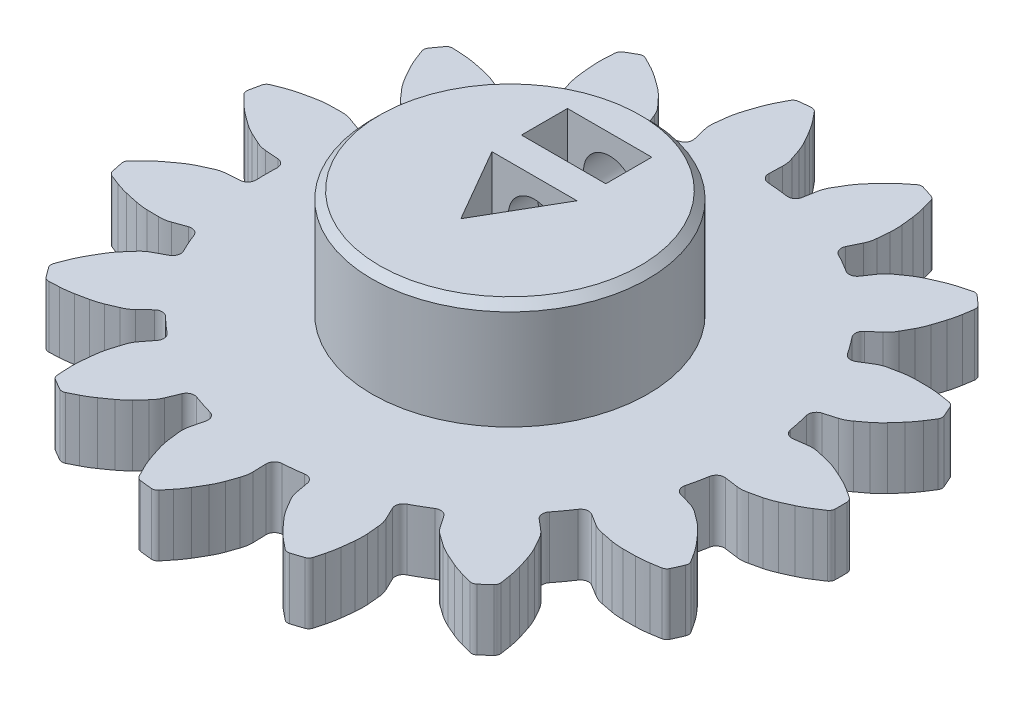
from build123d import *

# Parameters (mm, degrees)
BOSS_EXTRUDE1_DEPTH = 4
SKETCH2_R           = 9
BOSS_EXTRUDE2_DEPTH = 11
CUT_EXTRUDE1_DEPTH  = 711.462257137
SKETCH4_W           = 5.5
SKETCH4_H           = 3
CUT_EXTRUDE2_DEPTH  = 6
SKETCH5_R           = 1.7
CUT_EXTRUDE3_DEPTH  = 632.515680404
CHAMFER1_SIZE       = 0.5


with BuildPart() as part:
    # Sketch1 → Boss-Extrude1 (new body)
    with BuildSketch(Plane(origin=(0, 0, 0), x_dir=(1, 0, 0), z_dir=(0, 1, 0))):
        with BuildLine():
            Line((625.655538963, 307.001959395), (626.515572218, 307.118507349))
            ThreePointArc((626.515572218, 307.118507349), (626.884116246, 307.132277804), (627.248364172, 307.074504331))
            ThreePointArc((627.248364172, 307.074504331), (627.621576046, 306.989699865), (627.994774348, 306.904835695))
            ThreePointArc((627.994774348, 306.904835695), (628.37582392, 306.789350553), (628.746632196, 306.644309812))
            ThreePointArc((628.746632196, 306.644309812), (629.123956149, 306.476519105), (629.498991111, 306.303672745))
            ThreePointArc((629.498991111, 306.303672745), (629.880277829, 306.108693095), (630.247578808, 305.888496327))
            ThreePointArc((630.247578808, 305.888496327), (630.531649894, 305.70400205), (630.814613461, 305.517813601))
            ThreePointArc((630.814613461, 305.517813601), (630.944063756, 305.377153086), (630.993224545, 305.192420913))
            ThreePointArc((630.993224545, 305.192420913), (630.995899495, 304.99621856), (630.99679117, 304.8))
            ThreePointArc((630.99679117, 304.8), (630.995899495, 304.60378144), (630.993224545, 304.407579087))
            ThreePointArc((630.993224545, 304.407579087), (630.944063756, 304.222846914), (630.814613461, 304.082186399))
            ThreePointArc((630.814613461, 304.082186399), (630.531649894, 303.89599795), (630.247578808, 303.711503673))
            ThreePointArc((630.247578808, 303.711503673), (629.880277829, 303.491306905), (629.498991111, 303.296327255))
            ThreePointArc((629.498991111, 303.296327255), (629.123956149, 303.123480895), (628.746632196, 302.955690188))
            ThreePointArc((628.746632196, 302.955690188), (628.37582392, 302.810649447), (627.994774348, 302.695164305))
            ThreePointArc((627.994774348, 302.695164305), (627.621576046, 302.610300135), (627.248364172, 302.525495669))
            ThreePointArc((627.248364172, 302.525495669), (626.884116246, 302.467722196), (626.515572218, 302.481492651))
            Line((626.515572218, 302.481492651), (625.655538963, 302.598040605))
            ThreePointArc((625.655538963, 302.598040605), (625.269561163, 302.499520027), (625.060781309, 302.160261809))
            ThreePointArc((625.060781309, 302.160261809), (625.001333924, 301.829164882), (624.934884332, 301.499401908))
            ThreePointArc((624.934884332, 301.499401908), (624.86146237, 301.171120958), (624.781101006, 300.844469434))
            ThreePointArc((624.781101006, 300.844469434), (624.833842145, 300.449623213), (625.146378481, 300.202628872))
            Line((625.146378481, 300.202628872), (625.979462278, 299.959293687))
            ThreePointArc((625.979462278, 299.959293687), (626.32174495, 299.821973262), (626.6310034, 299.62104159))
            ThreePointArc((626.6310034, 299.62104159), (626.937456328, 299.39176991), (627.243872574, 299.162449209))
            ThreePointArc((627.243872574, 299.162449209), (627.545006641, 298.901961459), (627.824763473, 298.618638835))
            ThreePointArc((627.824763473, 298.618638835), (628.101219427, 298.311882918), (628.373527964, 298.00143945))
            ThreePointArc((628.373527964, 298.00143945), (628.642545346, 297.668233396), (628.888529393, 297.317678872))
            ThreePointArc((628.888529393, 297.317678872), (629.073000659, 297.033592844), (629.255771077, 296.74840958))
            ThreePointArc((629.255771077, 296.74840958), (629.316818019, 296.567257628), (629.286591291, 296.378500896))
            ThreePointArc((629.286591291, 296.378500896), (629.209232294, 296.198173127), (629.130237601, 296.018555876))
            ThreePointArc((629.130237601, 296.018555876), (629.049613737, 295.839663978), (628.967367361, 295.661512211))
            ThreePointArc((628.967367361, 295.661512211), (628.847319402, 295.512746467), (628.671848888, 295.436898871))
            ThreePointArc((628.671848888, 295.436898871), (628.337619141, 295.381898911), (628.003066709, 295.328897122))
            ThreePointArc((628.003066709, 295.328897122), (627.577958474, 295.277132132), (627.150330355, 295.254092638))
            ThreePointArc((627.150330355, 295.254092638), (626.737415921, 295.248730093), (626.324466709, 295.248917132))
            ThreePointArc((626.324466709, 295.248917132), (625.926723109, 295.267237135), (625.531644964, 295.316723033))
            ThreePointArc((625.531644964, 295.316723033), (625.156193983, 295.39098918), (624.780754887, 295.46531539))
            ThreePointArc((624.780754887, 295.46531539), (624.42449926, 295.560689675), (624.093418486, 295.723169972))
            Line((624.093418486, 295.723169972), (623.355143336, 296.179448865))
            ThreePointArc((623.355143336, 296.179448865), (622.962463141, 296.246437153), (622.633744505, 296.021427766))
            ThreePointArc((622.633744505, 296.021427766), (622.444767364, 295.743135102), (622.249935956, 295.46890912))
            ThreePointArc((622.249935956, 295.46890912), (622.049337764, 295.198872951), (621.843062861, 294.933147846))
            ThreePointArc((621.843062861, 294.933147846), (621.730645862, 294.550986121), (621.915700364, 294.198225583))
            Line((621.915700364, 294.198225583), (622.577786946, 293.637082123))
            ThreePointArc((622.577786946, 293.637082123), (622.834624477, 293.372414768), (623.035419856, 293.063067807))
            ThreePointArc((623.035419856, 293.063067807), (623.222125343, 292.728972071), (623.40877738, 292.39484647))
            ThreePointArc((623.40877738, 292.39484647), (623.577927126, 292.034396809), (623.718260016, 291.661781359))
            ThreePointArc((623.718260016, 291.661781359), (623.846046225, 291.269101118), (623.968543719, 290.874739037))
            ThreePointArc((623.968543719, 290.874739037), (624.078776214, 290.460920934), (624.160910453, 290.040622715))
            ThreePointArc((624.160910453, 290.040622715), (624.213885143, 289.706065991), (624.264859744, 289.371198689))
            ThreePointArc((624.264859744, 289.371198689), (624.246947764, 289.180878118), (624.142559994, 289.020734581))
            ThreePointArc((624.142559994, 289.020734581), (623.998543122, 288.887461706), (623.853320961, 288.755503218))
            ThreePointArc((623.853320961, 288.755503218), (623.706905507, 288.624870017), (623.559308852, 288.495572894))
            ThreePointArc((623.559308852, 288.495572894), (623.389131105, 288.408496529), (623.197980818, 288.41057659))
            ThreePointArc((623.197980818, 288.41057659), (622.870276251, 288.496275111), (622.543089627, 288.5839303))
            ThreePointArc((622.543089627, 288.5839303), (622.133679211, 288.709547726), (621.73365048, 288.862432126))
            ThreePointArc((621.73365048, 288.862432126), (621.354253231, 289.025480628), (620.97708143, 289.193613073))
            ThreePointArc((620.97708143, 289.193613073), (620.621175987, 289.372126125), (620.28038187, 289.5780265))
            ThreePointArc((620.28038187, 289.5780265), (619.967597095, 289.798581674), (619.654847608, 290.019186883))
            ThreePointArc((619.654847608, 290.019186883), (619.368184114, 290.251217846), (619.131813467, 290.534313666))
            Line((619.131813467, 290.534313666), (618.642950902, 291.251428732))
            ThreePointArc((618.642950902, 291.251428732), (618.311466286, 291.472343003), (617.919647307, 291.400488613))
            ThreePointArc((617.919647307, 291.400488613), (617.633816273, 291.223119543), (617.34429117, 291.051846715))
            ThreePointArc((617.34429117, 291.051846715), (617.051201999, 290.886747034), (616.754680361, 290.727894634))
            ThreePointArc((616.754680361, 290.727894634), (616.496543145, 290.424496639), (616.522118207, 290.026965405))
            Line((616.522118207, 290.026965405), (616.898726789, 289.245040471))
            ThreePointArc((616.898726789, 289.245040471), (617.025709638, 288.898789576), (617.083322599, 288.534516227))
            ThreePointArc((617.083322599, 288.534516227), (617.117997571, 288.153364622), (617.152611567, 287.772207474))
            ThreePointArc((617.152611567, 287.772207474), (617.160529464, 287.374120924), (617.137173581, 286.976641243))
            ThreePointArc((617.137173581, 286.976641243), (617.094194649, 286.565934659), (617.045700169, 286.155842752))
            ThreePointArc((617.045700169, 286.155842752), (616.978087577, 285.732965508), (616.882170251, 285.315596975))
            ThreePointArc((616.882170251, 285.315596975), (616.79448856, 284.988417452), (616.704853373, 284.661767712))
            ThreePointArc((616.704853373, 284.661767712), (616.611079615, 284.495186676), (616.450580397, 284.391346607))
            ThreePointArc((616.450580397, 284.391346607), (616.264807476, 284.328172716), (616.078468079, 284.266689813))
            ThreePointArc((616.078468079, 284.266689813), (615.891577596, 284.206902977), (615.704151465, 284.148817145))
            ThreePointArc((615.704151465, 284.148817145), (615.513269208, 284.138486452), (615.339490768, 284.218134509))
            ThreePointArc((615.339490768, 284.218134509), (615.074974479, 284.429713459), (614.811727202, 284.642869248))
            ThreePointArc((614.811727202, 284.642869248), (614.488805387, 284.924148695), (614.185544644, 285.226521888))
            ThreePointArc((614.185544644, 285.226521888), (613.90526581, 285.529788869), (613.629087851, 285.836795093))
            ThreePointArc((613.629087851, 285.836795093), (613.37655985, 286.144634666), (613.14897616, 286.471347474))
            ThreePointArc((613.14897616, 286.471347474), (612.95294092, 286.80005568), (612.756958269, 287.128795243))
            ThreePointArc((612.756958269, 287.128795243), (612.589453632, 287.457362622), (612.488663744, 287.812124126))
            Line((612.488663744, 287.812124126), (612.333742544, 288.666079656))
            ThreePointArc((612.333742544, 288.666079656), (612.120770207, 289.002721825), (611.733599945, 289.09644671))
            ThreePointArc((611.733599945, 289.09644671), (611.400337802, 289.050669956), (611.066180525, 289.011964911))
            ThreePointArc((611.066180525, 289.011964911), (610.731278154, 288.980348954), (610.395781066, 288.95583628))
            ThreePointArc((610.395781066, 288.95583628), (610.036557903, 288.783662284), (609.898231365, 288.410097116))
            Line((609.898231365, 288.410097116), (609.924242902, 287.542592635))
            ThreePointArc((609.924242902, 287.542592635), (609.89941458, 287.174628125), (609.80388332, 286.818414559))
            ThreePointArc((609.80388332, 286.818414559), (609.680532158, 286.45611166), (609.557123038, 286.093828498))
            ThreePointArc((609.557123038, 286.093828498), (609.40244001, 285.72693784), (609.219433798, 285.373321776))
            ThreePointArc((609.219433798, 285.373321776), (609.013121172, 285.015603748), (608.802019855, 284.660690632))
            ThreePointArc((608.802019855, 284.660690632), (608.568253009, 284.301873565), (608.310869095, 283.959601529))
            ThreePointArc((608.310869095, 283.959601529), (608.097691984, 283.696371518), (607.882945747, 283.434420047))
            ThreePointArc((607.882945747, 283.434420047), (607.729524545, 283.320381922), (607.540665652, 283.290800211))
            ThreePointArc((607.540665652, 283.290800211), (607.345258508, 283.308648645), (607.150021648, 283.328272279))
            ThreePointArc((607.150021648, 283.328272279), (606.954971199, 283.349669494), (606.760123272, 283.372838521))
            ThreePointArc((606.760123272, 283.372838521), (606.581541783, 283.441039772), (606.455183062, 283.584483952))
            ThreePointArc((606.455183062, 283.584483952), (606.299592319, 283.885359408), (606.145802235, 284.187159225))
            ThreePointArc((606.145802235, 284.187159225), (605.965205135, 284.575464921), (605.811148918, 284.975043834))
            ThreePointArc((605.811148918, 284.975043834), (605.678451257, 285.36609168), (605.551020818, 285.758887517))
            ThreePointArc((605.551020818, 285.758887517), (605.445534644, 286.142825352), (605.370512669, 286.533858979))
            ThreePointArc((605.370512669, 286.533858979), (605.325123238, 286.913883583), (605.279794604, 287.293915444))
            ThreePointArc((605.279794604, 287.293915444), (605.260411896, 287.662206954), (605.312630256, 288.027292655))
            Line((605.312630256, 288.027292655), (605.518437702, 288.87043198))
            ThreePointArc((605.518437702, 288.87043198), (605.460802497, 289.264593557), (605.145226208, 289.507691833))
            ThreePointArc((605.145226208, 289.507691833), (604.822157008, 289.601422613), (604.501146384, 289.701977804))
            ThreePointArc((604.501146384, 289.701977804), (604.182338476, 289.809312256), (603.865876433, 289.923377773))
            ThreePointArc((603.865876433, 289.923377773), (603.467680271, 289.912198225), (603.189370048, 289.627191934))
            Line((603.189370048, 289.627191934), (602.86028691, 288.82410731))
            ThreePointArc((602.86028691, 288.82410731), (602.687940459, 288.498053592), (602.455783201, 288.211492371))
            ThreePointArc((602.455783201, 288.211492371), (602.195734442, 287.930683641), (601.935640764, 287.649916515))
            ThreePointArc((601.935640764, 287.649916515), (601.645102911, 287.377660477), (601.334089807, 287.12905146))
            ThreePointArc((601.334089807, 287.12905146), (601.000116815, 286.886174686), (600.662909996, 286.647808061))
            ThreePointArc((600.662909996, 286.647808061), (600.303409306, 286.415093902), (599.929062822, 286.207100307))
            ThreePointArc((599.929062822, 286.207100307), (599.627250549, 286.053334669), (599.324524838, 285.901375256))
            ThreePointArc((599.324524838, 285.901375256), (599.137984112, 285.85959827), (598.953420962, 285.909389864))
            ThreePointArc((598.953420962, 285.909389864), (598.782167265, 286.005174465), (598.61179117, 286.102511532))
            ThreePointArc((598.61179117, 286.102511532), (598.44230675, 286.201393025), (598.273728004, 286.301810777))
            ThreePointArc((598.273728004, 286.301810777), (598.138325643, 286.436751356), (598.081235211, 286.619188856))
            ThreePointArc((598.081235211, 286.619188856), (598.061473068, 286.957336719), (598.04373188, 287.295596634))
            ThreePointArc((598.04373188, 287.295596634), (598.036686375, 287.723786997), (598.058472404, 288.151480806))
            ThreePointArc((598.058472404, 288.151480806), (598.096300546, 288.56269379), (598.139651507, 288.973361272))
            ThreePointArc((598.139651507, 288.973361272), (598.199446679, 289.36701103), (598.289958399, 289.75475221))
            ThreePointArc((598.289958399, 289.75475221), (598.403063022, 290.120383505), (598.516226138, 290.485996702))
            ThreePointArc((598.516226138, 290.485996702), (598.648316805, 290.830331396), (598.844514383, 291.14261466))
            Line((598.844514383, 291.14261466), (599.375464499, 291.82915133))
            ThreePointArc((599.375464499, 291.82915133), (599.483132076, 292.212678198), (599.293715768, 292.563115964))
            ThreePointArc((599.293715768, 292.563115964), (599.03670111, 292.780147374), (598.784342794, 293.002575896))
            ThreePointArc((598.784342794, 293.002575896), (598.536754132, 293.230301655), (598.294046296, 293.463222399))
            ThreePointArc((598.294046296, 293.463222399), (597.925728869, 293.614970344), (597.555557328, 293.467803108))
            Line((597.555557328, 293.467803108), (596.928280977, 292.867998968))
            ThreePointArc((596.928280977, 292.867998968), (596.638216665, 292.640233692), (596.309575507, 292.472873854))
            ThreePointArc((596.309575507, 292.472873854), (595.957793944, 292.322113673), (595.605988268, 292.171409771))
            ThreePointArc((595.605988268, 292.171409771), (595.229832225, 292.040863894), (594.84458922, 291.940248682))
            ThreePointArc((594.84458922, 291.940248682), (594.440702826, 291.854208762), (594.035696628, 291.773604384))
            ThreePointArc((594.035696628, 291.773604384), (593.61262303, 291.707231525), (593.186041883, 291.669480353))
            ThreePointArc((593.186041883, 291.669480353), (592.847780532, 291.651766564), (592.509419372, 291.636074372))
            ThreePointArc((592.509419372, 291.636074372), (592.322013708, 291.673782145), (592.173658947, 291.794337626))
            ThreePointArc((592.173658947, 291.794337626), (592.056170018, 291.951496366), (591.940114262, 292.109716403))
            ThreePointArc((591.940114262, 292.109716403), (591.825501266, 292.268984666), (591.712340497, 292.429288))
            ThreePointArc((591.712340497, 292.429288), (591.643529564, 292.607635455), (591.665578876, 292.797521175))
            ThreePointArc((591.665578876, 292.797521175), (591.785062386, 293.114472607), (591.906437706, 293.430704407))
            ThreePointArc((591.906437706, 293.430704407), (592.074162028, 293.824741433), (592.2680233, 294.206597994))
            ThreePointArc((592.2680233, 294.206597994), (592.469836417, 294.566873655), (592.676473003, 294.924404644))
            ThreePointArc((592.676473003, 294.924404644), (592.891210392, 295.259700705), (593.131605508, 295.577105466))
            ThreePointArc((593.131605508, 295.577105466), (593.383647369, 295.86512248), (593.635735303, 296.153099169))
            ThreePointArc((593.635735303, 296.153099169), (593.89645967, 296.41393845), (594.202712122, 296.619422663))
            Line((594.202712122, 296.619422663), (594.96699881, 297.030648251))
            ThreePointArc((594.96699881, 297.030648251), (595.221352467, 297.337225131), (595.190847939, 297.734408514))
            ThreePointArc((595.190847939, 297.734408514), (595.044327993, 298.037213851), (594.90425703, 298.343055791))
            ThreePointArc((594.90425703, 298.343055791), (594.770697944, 298.651797005), (594.643710704, 298.963298864))
            ThreePointArc((594.643710704, 298.963298864), (594.368957441, 299.251735703), (593.970930603, 299.267854073))
            Line((593.970930603, 299.267854073), (593.15392282, 298.975042004))
            ThreePointArc((593.15392282, 298.975042004), (592.796295402, 298.884947854), (592.427995386, 298.865727436))
            ThreePointArc((592.427995386, 298.865727436), (592.045307247, 298.871083609), (591.66261997, 298.876501004))
            ThreePointArc((591.66261997, 298.876501004), (591.265886535, 298.910237857), (590.873025643, 298.975013734))
            ThreePointArc((590.873025643, 298.975013734), (590.469061475, 299.060687751), (590.066285148, 299.15178285))
            ThreePointArc((590.066285148, 299.15178285), (589.65279191, 299.263227761), (589.247735856, 299.402246533))
            ThreePointArc((589.247735856, 299.402246533), (588.931513889, 299.523647468), (588.616022998, 299.64693582))
            ThreePointArc((588.616022998, 299.64693582), (588.460156538, 299.757608335), (588.373662052, 299.928082564))
            ThreePointArc((588.373662052, 299.928082564), (588.330252793, 300.119441271), (588.28858447, 300.311186595))
            ThreePointArc((588.28858447, 300.311186595), (588.248660527, 300.503302699), (588.210484261, 300.695773713))
            ThreePointArc((588.210484261, 300.695773713), (588.22016279, 300.886690148), (588.31753932, 301.051191122))
            ThreePointArc((588.31753932, 301.051191122), (588.555608699, 301.292142341), (588.795113633, 301.531666675))
            ThreePointArc((588.795113633, 301.531666675), (589.108606722, 301.823417782), (589.441022862, 302.093410626))
            ThreePointArc((589.441022862, 302.093410626), (589.771925631, 302.340454031), (590.1061185, 302.58302817))
            ThreePointArc((590.1061185, 302.58302817), (590.43866806, 302.801994799), (590.787380074, 302.994180973))
            ThreePointArc((590.787380074, 302.994180973), (591.134778845, 303.154782948), (591.482203303, 303.315329344))
            ThreePointArc((591.482203303, 303.315329344), (591.826479758, 303.447571731), (592.189833254, 303.510726805))
            Line((592.189833254, 303.510726805), (593.055304401, 303.575536672))
            ThreePointArc((593.055304401, 303.575536672), (593.41236408, 303.752153636), (593.546045843, 304.12740602))
            ThreePointArc((593.546045843, 304.12740602), (593.535355238, 304.463627492), (593.53179117, 304.8))
            ThreePointArc((593.53179117, 304.8), (593.535355238, 305.136372508), (593.546045843, 305.47259398))
            ThreePointArc((593.546045843, 305.47259398), (593.41236408, 305.847846364), (593.055304401, 306.024463328))
            Line((593.055304401, 306.024463328), (592.189833254, 306.089273195))
            ThreePointArc((592.189833254, 306.089273195), (591.826479758, 306.152428269), (591.482203303, 306.284670656))
            ThreePointArc((591.482203303, 306.284670656), (591.134778845, 306.445217052), (590.787380074, 306.605819027))
            ThreePointArc((590.787380074, 306.605819027), (590.43866806, 306.798005201), (590.1061185, 307.01697183))
            ThreePointArc((590.1061185, 307.01697183), (589.771925631, 307.259545969), (589.441022862, 307.506589374))
            ThreePointArc((589.441022862, 307.506589374), (589.108606722, 307.776582218), (588.795113633, 308.068333325))
            ThreePointArc((588.795113633, 308.068333325), (588.555608699, 308.307857659), (588.31753932, 308.548808878))
            ThreePointArc((588.31753932, 308.548808878), (588.22016279, 308.713309852), (588.210484261, 308.904226287))
            ThreePointArc((588.210484261, 308.904226287), (588.248660527, 309.096697301), (588.28858447, 309.288813405))
            ThreePointArc((588.28858447, 309.288813405), (588.330252793, 309.480558729), (588.373662052, 309.671917436))
            ThreePointArc((588.373662052, 309.671917436), (588.460156538, 309.842391665), (588.616022998, 309.95306418))
            ThreePointArc((588.616022998, 309.95306418), (588.931513889, 310.076352532), (589.247735856, 310.197753467))
            ThreePointArc((589.247735856, 310.197753467), (589.65279191, 310.336772239), (590.066285148, 310.44821715))
            ThreePointArc((590.066285148, 310.44821715), (590.469061475, 310.539312249), (590.873025643, 310.624986266))
            ThreePointArc((590.873025643, 310.624986266), (591.265886535, 310.689762143), (591.66261997, 310.723498996))
            ThreePointArc((591.66261997, 310.723498996), (592.045307247, 310.728916391), (592.427995386, 310.734272564))
            ThreePointArc((592.427995386, 310.734272564), (592.796295402, 310.715052146), (593.15392282, 310.624957996))
            Line((593.15392282, 310.624957996), (593.970930603, 310.332145927))
            ThreePointArc((593.970930603, 310.332145927), (594.368957441, 310.348264297), (594.643710704, 310.636701136))
            ThreePointArc((594.643710704, 310.636701136), (594.770697944, 310.948202995), (594.90425703, 311.256944209))
            ThreePointArc((594.90425703, 311.256944209), (595.044327993, 311.562786149), (595.190847939, 311.865591486))
            ThreePointArc((595.190847939, 311.865591486), (595.221352467, 312.262774869), (594.96699881, 312.569351749))
            Line((594.96699881, 312.569351749), (594.202712122, 312.980577337))
            ThreePointArc((594.202712122, 312.980577337), (593.89645967, 313.18606155), (593.635735303, 313.446900831))
            ThreePointArc((593.635735303, 313.446900831), (593.383647369, 313.73487752), (593.131605508, 314.022894534))
            ThreePointArc((593.131605508, 314.022894534), (592.891210392, 314.340299295), (592.676473003, 314.675595356))
            ThreePointArc((592.676473003, 314.675595356), (592.469836417, 315.033126345), (592.2680233, 315.393402006))
            ThreePointArc((592.2680233, 315.393402006), (592.074162028, 315.775258567), (591.906437706, 316.169295593))
            ThreePointArc((591.906437706, 316.169295593), (591.785062386, 316.485527393), (591.665578876, 316.802478825))
            ThreePointArc((591.665578876, 316.802478825), (591.643529564, 316.992364545), (591.712340497, 317.170712))
            ThreePointArc((591.712340497, 317.170712), (591.825501266, 317.331015334), (591.940114262, 317.490283597))
            ThreePointArc((591.940114262, 317.490283597), (592.056170018, 317.648503634), (592.173658947, 317.805662374))
            ThreePointArc((592.173658947, 317.805662374), (592.322013708, 317.926217855), (592.509419372, 317.963925628))
            ThreePointArc((592.509419372, 317.963925628), (592.847780532, 317.948233436), (593.186041883, 317.930519647))
            ThreePointArc((593.186041883, 317.930519647), (593.61262303, 317.892768475), (594.035696628, 317.826395616))
            ThreePointArc((594.035696628, 317.826395616), (594.440702826, 317.745791238), (594.84458922, 317.659751318))
            ThreePointArc((594.84458922, 317.659751318), (595.229832225, 317.559136106), (595.605988268, 317.428590229))
            ThreePointArc((595.605988268, 317.428590229), (595.957793944, 317.277886327), (596.309575507, 317.127126146))
            ThreePointArc((596.309575507, 317.127126146), (596.638216665, 316.959766308), (596.928280977, 316.732001032))
            Line((596.928280977, 316.732001032), (597.555557328, 316.132196892))
            ThreePointArc((597.555557328, 316.132196892), (597.925728869, 315.985029656), (598.294046296, 316.136777601))
            ThreePointArc((598.294046296, 316.136777601), (598.536754132, 316.369698345), (598.784342794, 316.597424104))
            ThreePointArc((598.784342794, 316.597424104), (599.03670111, 316.819852626), (599.293715768, 317.036884036))
            ThreePointArc((599.293715768, 317.036884036), (599.483132076, 317.387321802), (599.375464499, 317.77084867))
            Line((599.375464499, 317.77084867), (598.844514383, 318.45738534))
            ThreePointArc((598.844514383, 318.45738534), (598.648316805, 318.769668604), (598.516226138, 319.114003298))
            ThreePointArc((598.516226138, 319.114003298), (598.403063023, 319.479616495), (598.289958399, 319.84524779))
            ThreePointArc((598.289958399, 319.84524779), (598.199446679, 320.23298897), (598.139651507, 320.626638728))
            ThreePointArc((598.139651507, 320.626638728), (598.096300546, 321.03730621), (598.058472404, 321.448519194))
            ThreePointArc((598.058472404, 321.448519194), (598.036686375, 321.876213003), (598.04373188, 322.304403366))
            ThreePointArc((598.04373188, 322.304403366), (598.061473068, 322.642663281), (598.081235211, 322.980811144))
            ThreePointArc((598.081235211, 322.980811144), (598.138325643, 323.163248644), (598.273728004, 323.298189223))
            ThreePointArc((598.273728004, 323.298189223), (598.44230675, 323.398606975), (598.61179117, 323.497488468))
            ThreePointArc((598.61179117, 323.497488468), (598.782167265, 323.594825535), (598.953420962, 323.690610136))
            ThreePointArc((598.953420962, 323.690610136), (599.137984112, 323.74040173), (599.324524838, 323.698624744))
            ThreePointArc((599.324524838, 323.698624744), (599.627250549, 323.546665331), (599.929062822, 323.392899693))
            ThreePointArc((599.929062822, 323.392899693), (600.303409306, 323.184906098), (600.662909996, 322.952191939))
            ThreePointArc((600.662909996, 322.952191939), (601.000116815, 322.713825314), (601.334089807, 322.47094854))
            ThreePointArc((601.334089807, 322.47094854), (601.645102911, 322.222339523), (601.935640764, 321.950083485))
            ThreePointArc((601.935640764, 321.950083485), (602.195734442, 321.669316359), (602.455783201, 321.388507629))
            ThreePointArc((602.455783201, 321.388507629), (602.687940459, 321.101946408), (602.86028691, 320.77589269))
            Line((602.86028691, 320.77589269), (603.189370048, 319.972808066))
            ThreePointArc((603.189370048, 319.972808066), (603.467680271, 319.687801775), (603.865876433, 319.676622227))
            ThreePointArc((603.865876433, 319.676622227), (604.182338476, 319.790687744), (604.501146384, 319.898022196))
            ThreePointArc((604.501146384, 319.898022196), (604.822157008, 319.998577387), (605.145226208, 320.092308167))
            ThreePointArc((605.145226208, 320.092308167), (605.460802497, 320.335406443), (605.518437702, 320.72956802))
            Line((605.518437702, 320.72956802), (605.312630256, 321.572707345))
            ThreePointArc((605.312630256, 321.572707345), (605.260411896, 321.937793046), (605.279794604, 322.306084556))
            ThreePointArc((605.279794604, 322.306084556), (605.325123238, 322.686116417), (605.370512669, 323.066141021))
            ThreePointArc((605.370512669, 323.066141021), (605.445534644, 323.457174648), (605.551020818, 323.841112483))
            ThreePointArc((605.551020818, 323.841112483), (605.678451257, 324.23390832), (605.811148918, 324.624956166))
            ThreePointArc((605.811148918, 324.624956166), (605.965205135, 325.024535079), (606.145802235, 325.412840775))
            ThreePointArc((606.145802235, 325.412840775), (606.299592319, 325.714640592), (606.455183062, 326.015516048))
            ThreePointArc((606.455183062, 326.015516048), (606.581541783, 326.158960228), (606.760123272, 326.227161479))
            ThreePointArc((606.760123272, 326.227161479), (606.954971199, 326.250330506), (607.150021648, 326.271727721))
            ThreePointArc((607.150021648, 326.271727721), (607.345258508, 326.291351355), (607.540665652, 326.309199789))
            ThreePointArc((607.540665652, 326.309199789), (607.729524545, 326.279618078), (607.882945747, 326.165579953))
            ThreePointArc((607.882945747, 326.165579953), (608.097691984, 325.903628482), (608.310869095, 325.640398471))
            ThreePointArc((608.310869095, 325.640398471), (608.568253009, 325.298126435), (608.802019855, 324.939309368))
            ThreePointArc((608.802019855, 324.939309368), (609.013121172, 324.584396252), (609.219433798, 324.226678224))
            ThreePointArc((609.219433798, 324.226678224), (609.40244001, 323.87306216), (609.557123038, 323.506171502))
            ThreePointArc((609.557123038, 323.506171502), (609.680532158, 323.14388834), (609.80388332, 322.781585441))
            ThreePointArc((609.80388332, 322.781585441), (609.89941458, 322.425371875), (609.924242902, 322.057407365))
            Line((609.924242902, 322.057407365), (609.898231365, 321.189902884))
            ThreePointArc((609.898231365, 321.189902884), (610.036557903, 320.816337716), (610.395781066, 320.64416372))
            ThreePointArc((610.395781066, 320.64416372), (610.731278154, 320.619651046), (611.066180525, 320.588035089))
            ThreePointArc((611.066180525, 320.588035089), (611.400337802, 320.549330044), (611.733599945, 320.50355329))
            ThreePointArc((611.733599945, 320.50355329), (612.120770207, 320.597278175), (612.333742544, 320.933920344))
            Line((612.333742544, 320.933920344), (612.488663744, 321.787875874))
            ThreePointArc((612.488663744, 321.787875874), (612.589453632, 322.142637378), (612.756958269, 322.471204757))
            ThreePointArc((612.756958269, 322.471204757), (612.95294092, 322.79994432), (613.14897616, 323.128652526))
            ThreePointArc((613.14897616, 323.128652526), (613.37655985, 323.455365334), (613.629087851, 323.763204907))
            ThreePointArc((613.629087851, 323.763204907), (613.90526581, 324.070211131), (614.185544644, 324.373478112))
            ThreePointArc((614.185544644, 324.373478112), (614.488805387, 324.675851305), (614.811727202, 324.957130752))
            ThreePointArc((614.811727202, 324.957130752), (615.074974479, 325.170286541), (615.339490768, 325.381865491))
            ThreePointArc((615.339490768, 325.381865491), (615.513269208, 325.461513548), (615.704151465, 325.451182855))
            ThreePointArc((615.704151465, 325.451182855), (615.891577596, 325.393097023), (616.078468079, 325.333310187))
            ThreePointArc((616.078468079, 325.333310187), (616.264807476, 325.271827284), (616.450580397, 325.208653393))
            ThreePointArc((616.450580397, 325.208653393), (616.611079615, 325.104813324), (616.704853373, 324.938232288))
            ThreePointArc((616.704853373, 324.938232288), (616.79448856, 324.611582548), (616.882170251, 324.284403025))
            ThreePointArc((616.882170251, 324.284403025), (616.978087577, 323.867034492), (617.045700169, 323.444157248))
            ThreePointArc((617.045700169, 323.444157248), (617.094194649, 323.034065341), (617.137173581, 322.623358757))
            ThreePointArc((617.137173581, 322.623358757), (617.160529464, 322.225879076), (617.152611567, 321.827792526))
            ThreePointArc((617.152611567, 321.827792526), (617.117997571, 321.446635378), (617.083322599, 321.065483773))
            ThreePointArc((617.083322599, 321.065483773), (617.025709638, 320.701210424), (616.898726789, 320.354959529))
            Line((616.898726789, 320.354959529), (616.522118207, 319.573034595))
            ThreePointArc((616.522118207, 319.573034595), (616.496543145, 319.175503361), (616.754680361, 318.872105366))
            ThreePointArc((616.754680361, 318.872105366), (617.051201999, 318.713252966), (617.34429117, 318.548153285))
            ThreePointArc((617.34429117, 318.548153285), (617.633816273, 318.376880457), (617.919647307, 318.199511387))
            ThreePointArc((617.919647307, 318.199511387), (618.311466286, 318.127656997), (618.642950902, 318.348571268))
            Line((618.642950902, 318.348571268), (619.131813467, 319.065686334))
            ThreePointArc((619.131813467, 319.065686334), (619.368184114, 319.348782154), (619.654847608, 319.580813117))
            ThreePointArc((619.654847608, 319.580813117), (619.967597095, 319.801418326), (620.28038187, 320.0219735))
            ThreePointArc((620.28038187, 320.0219735), (620.621175986, 320.227873875), (620.97708143, 320.406386927))
            ThreePointArc((620.97708143, 320.406386927), (621.354253231, 320.574519372), (621.73365048, 320.737567874))
            ThreePointArc((621.73365048, 320.737567874), (622.133679211, 320.890452274), (622.543089627, 321.0160697))
            ThreePointArc((622.543089627, 321.0160697), (622.870276251, 321.103724889), (623.197980818, 321.18942341))
            ThreePointArc((623.197980818, 321.18942341), (623.389131105, 321.191503471), (623.559308852, 321.104427106))
            ThreePointArc((623.559308852, 321.104427106), (623.706905507, 320.975129983), (623.853320961, 320.844496782))
            ThreePointArc((623.853320961, 320.844496782), (623.998543122, 320.712538294), (624.142559994, 320.579265419))
            ThreePointArc((624.142559994, 320.579265419), (624.246947764, 320.419121882), (624.264859744, 320.228801311))
            ThreePointArc((624.264859744, 320.228801311), (624.213885143, 319.893934009), (624.160910453, 319.559377285))
            ThreePointArc((624.160910453, 319.559377285), (624.078776214, 319.139079066), (623.968543719, 318.725260963))
            ThreePointArc((623.968543719, 318.725260963), (623.846046225, 318.330898882), (623.718260016, 317.938218641))
            ThreePointArc((623.718260016, 317.938218641), (623.577927126, 317.565603191), (623.40877738, 317.20515353))
            ThreePointArc((623.40877738, 317.20515353), (623.222125343, 316.871027929), (623.035419856, 316.536932193))
            ThreePointArc((623.035419856, 316.536932193), (622.834624477, 316.227585232), (622.577786946, 315.962917877))
            Line((622.577786946, 315.962917877), (621.915700364, 315.401774417))
            ThreePointArc((621.915700364, 315.401774417), (621.730645862, 315.049013879), (621.843062861, 314.666852154))
            ThreePointArc((621.843062861, 314.666852154), (622.049337764, 314.401127049), (622.249935956, 314.13109088))
            ThreePointArc((622.249935956, 314.13109088), (622.444767364, 313.856864898), (622.633744505, 313.578572234))
            ThreePointArc((622.633744505, 313.578572234), (622.962463141, 313.353562847), (623.355143336, 313.420551135))
            Line((623.355143336, 313.420551135), (624.093418486, 313.876830028))
            ThreePointArc((624.093418486, 313.876830028), (624.42449926, 314.039310325), (624.780754887, 314.13468461))
            ThreePointArc((624.780754887, 314.13468461), (625.156193983, 314.20901082), (625.531644964, 314.283276967))
            ThreePointArc((625.531644964, 314.283276967), (625.926723109, 314.332762865), (626.324466709, 314.351082868))
            ThreePointArc((626.324466709, 314.351082868), (626.737415921, 314.351269907), (627.150330355, 314.345907362))
            ThreePointArc((627.150330355, 314.345907362), (627.577958474, 314.322867868), (628.003066709, 314.271102878))
            ThreePointArc((628.003066709, 314.271102878), (628.337619141, 314.218101089), (628.671848888, 314.163101129))
            ThreePointArc((628.671848888, 314.163101129), (628.847319402, 314.087253533), (628.967367361, 313.938487789))
            ThreePointArc((628.967367361, 313.938487789), (629.049613737, 313.760336022), (629.130237601, 313.581444124))
            ThreePointArc((629.130237601, 313.581444124), (629.209232294, 313.401826873), (629.286591291, 313.221499104))
            ThreePointArc((629.286591291, 313.221499104), (629.316818019, 313.032742372), (629.255771077, 312.85159042))
            ThreePointArc((629.255771077, 312.85159042), (629.073000659, 312.566407156), (628.888529393, 312.282321128))
            ThreePointArc((628.888529393, 312.282321128), (628.642545346, 311.931766604), (628.373527964, 311.59856055))
            ThreePointArc((628.373527964, 311.59856055), (628.101219427, 311.288117082), (627.824763473, 310.981361165))
            ThreePointArc((627.824763473, 310.981361165), (627.545006641, 310.698038541), (627.243872574, 310.437550791))
            ThreePointArc((627.243872574, 310.437550791), (626.937456328, 310.20823009), (626.6310034, 309.97895841))
            ThreePointArc((626.6310034, 309.97895841), (626.32174495, 309.778026738), (625.979462278, 309.640706313))
            Line((625.979462278, 309.640706313), (625.146378481, 309.397371128))
            ThreePointArc((625.146378481, 309.397371128), (624.833842145, 309.150376787), (624.781101006, 308.755530566))
            ThreePointArc((624.781101006, 308.755530566), (624.86146237, 308.428879042), (624.934884332, 308.100598092))
            ThreePointArc((624.934884332, 308.100598092), (625.001333924, 307.770835118), (625.060781309, 307.439738191))
            ThreePointArc((625.060781309, 307.439738191), (625.269561163, 307.100479973), (625.655538963, 307.001959395))
        make_face()
    extrude(amount=BOSS_EXTRUDE1_DEPTH)

    # Sketch2 → Boss-Extrude2 (add)
    with BuildSketch(Plane(origin=(0, 0, 0), x_dir=(1, 0, 0), z_dir=(0, 1, 0))):
        with Locations((609.40679117, 304.8)):
            Circle(SKETCH2_R)
    extrude(amount=BOSS_EXTRUDE2_DEPTH)

    # Sketch3 → Cut-Extrude1 (cut, through all)
    with BuildSketch(Plane(origin=(0, 0, 0), x_dir=(1, 0, 0), z_dir=(0, 1, 0))):
        Polygon((612.178072462, 306.4), (606.635509878, 306.4), (609.40679117, 301.6), align=None)
    extrude(amount=CUT_EXTRUDE1_DEPTH, mode=Mode.SUBTRACT)

    # Sketch4 → Cut-Extrude2 (cut)
    with BuildSketch(Plane(origin=(0, 11, 0), x_dir=(1, 0, 0), z_dir=(0, 1, 0))):
        with Locations((609.40679117, 309.8)):
            Rectangle(SKETCH4_W, SKETCH4_H)
    extrude(amount=-CUT_EXTRUDE2_DEPTH, mode=Mode.SUBTRACT)

    # Sketch5 → Cut-Extrude3 (cut, through all)
    with BuildSketch(Plane.XY.offset(-306.4)):
        with Locations((609.40679117, 8)):
            Circle(SKETCH5_R)
    extrude(amount=-CUT_EXTRUDE3_DEPTH, mode=Mode.SUBTRACT)

    # Chamfer1
    chamfer1_edges = [part.edges().sort_by_distance(p)[0] for p in [
        (600.40679117, 11, -304.8),
    ]]
    chamfer(chamfer1_edges, length=CHAMFER1_SIZE)


solid = part.part
